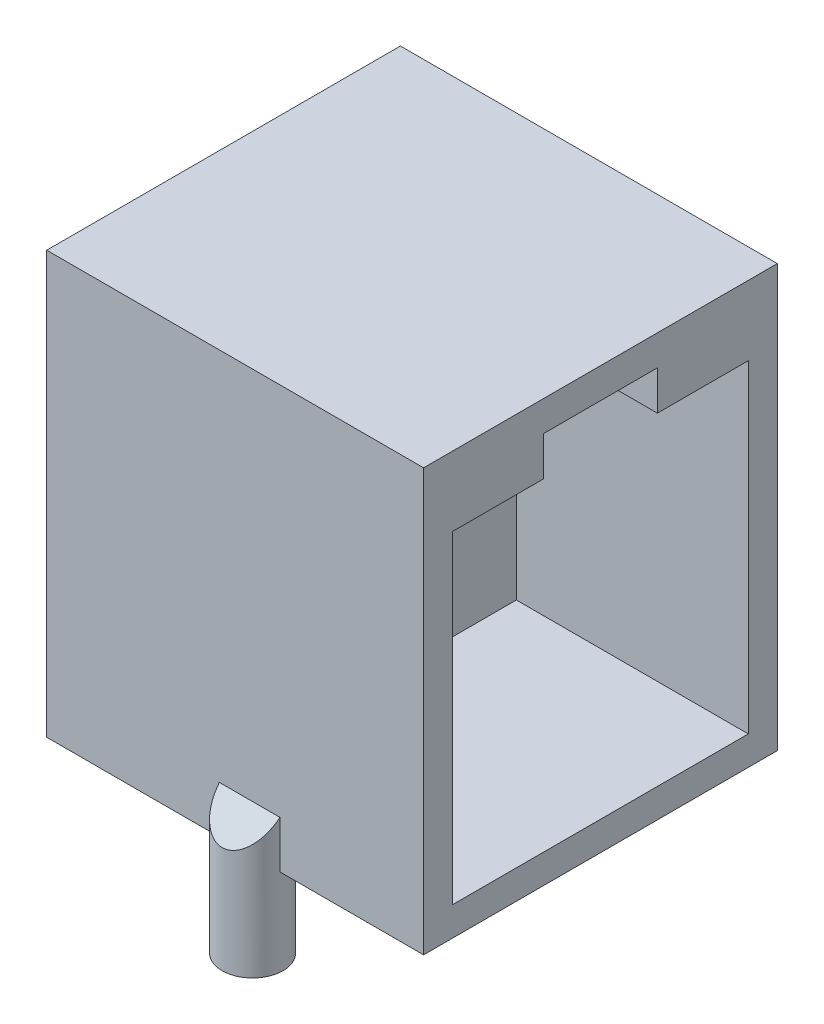
from build123d import *

# Parameters (mm, degrees)
SKETCH1_W           = 13
SKETCH1_H           = 12.2
BOSS_EXTRUDE1_DEPTH = 14.55
SKETCH2_R           = 1.05
BOSS_EXTRUDE2_DEPTH = 3
CUT_EXTRUDE1_DEPTH  = 8
CHAMFER1_SIZE       = 1.63


with BuildPart() as part:
    # Sketch1 → Boss-Extrude1 (new body)
    with BuildSketch(Plane(origin=(0, 0, 0), x_dir=(1, 0, 0), z_dir=(0, 1, 0))):
        with Locations((6.5, 6.1)):
            Rectangle(SKETCH1_W, SKETCH1_H)
    extrude(amount=BOSS_EXTRUDE1_DEPTH)

    # Sketch2 → Boss-Extrude2 (add)
    with BuildSketch(Plane.XZ):
        with Locations(Location((7, -0.1, 0), (0, 0, 174.5349762))):
            Circle(SKETCH2_R)
        with Locations(Location((7, -12.1, 0), (0, 0, 354.5349762))):
            Circle(SKETCH2_R)
    extrude(amount=BOSS_EXTRUDE2_DEPTH)

    # Sketch3 → Cut-Extrude1 (cut)
    with BuildSketch(Plane(origin=(13, 0, 0), x_dir=(0, 0, -1), z_dir=(1, 0, 0))):
        Polygon((1.000271868, 12.149637893), (1.000271868, 1.000271868), (11.199728132, 1.000271868), (11.199728132, 12.149637893), (8.065074736, 12.149637893), (8.065074736, 13.503489481), (4.134925264, 13.503489481), (4.134925264, 12.149637893), align=None)
    extrude(amount=-CUT_EXTRUDE1_DEPTH, mode=Mode.SUBTRACT)

    # Chamfer1
    # the kernel refuses this chamfer: 1.63 mm, written as the material it adds along each edge
    with BuildSketch(Plane(origin=(1.762929482, 0, 0), x_dir=(0, 0.9996219169112968, -0.027495876610586376), z_dir=(1, 0, 0))) as chamfer1_piece_1_section:
        Polygon((CHAMFER1_SIZE * 0.999621916911, CHAMFER1_SIZE * 0.0274958766106), (-CHAMFER1_SIZE * 0.0274958766106, CHAMFER1_SIZE * 0.999621916911), (0, 0), align=None)
    chamfer1_piece_1 = extrude(amount=10.474141037, mode=Mode.PRIVATE)
    chamfer1_piece_1 = chamfer1_piece_1 & Plane(origin=(7, 0.64054065, -0.1), x_dir=(-0.9954545219220755, 0, 0.09523809523973083), z_dir=(0, 1, 0)) * Cylinder(1.05, 28, mode=Mode.PRIVATE)
    add(chamfer1_piece_1)
    with BuildSketch(Plane(origin=(12.237070518, 0, -12.2), x_dir=(0, 0.9996219169112968, 0.02749587661058688), z_dir=(-1, 0, 0))) as chamfer1_piece_2_section:
        Polygon((CHAMFER1_SIZE * 0.999621916911, CHAMFER1_SIZE * 0.0274958766106), (-CHAMFER1_SIZE * 0.0274958766106, CHAMFER1_SIZE * 0.999621916911), (0, 0), align=None)
    chamfer1_piece_2 = extrude(amount=10.474141037, mode=Mode.PRIVATE)
    chamfer1_piece_2 = chamfer1_piece_2 & Plane(origin=(7, 0.64054065, -12.1), x_dir=(0.9954545219220756, 0, -0.09523809523973051), z_dir=(0, 1, 0)) * Cylinder(1.05, 28, mode=Mode.PRIVATE)
    add(chamfer1_piece_2)


solid = part.part
